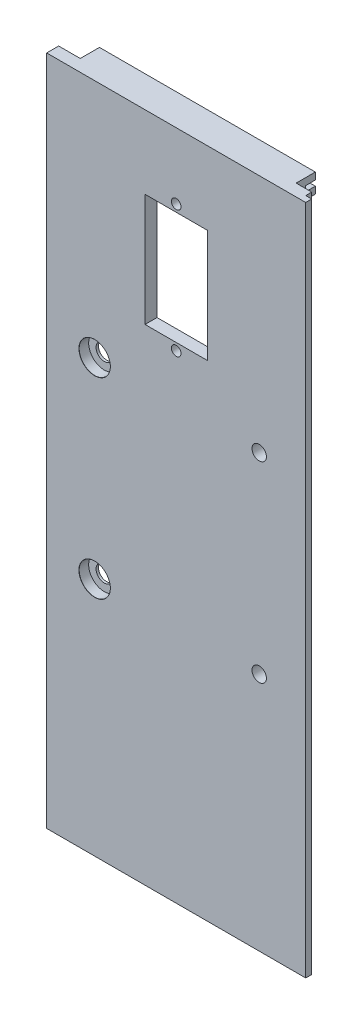
from build123d import *

# Parameters (mm, degrees)
ESBO_O1_W                                    = 54
ESBO_O1_H                                    = 140
RESSALTO_EXTRUS_O1_DEPTH                     = 2.5
ESBO_O2_W                                    = 45
ESBO_O2_H                                    = 4
RESSALTO_EXTRUS_O2_DEPTH                     = 4
FILETE1_R                                    = 2
ESBO_O3_W                                    = 45
ESBO_O3_H                                    = 1.1
CORTE_EXTRUS_O1_DEPTH                        = 2
REBAIXO_PARA_PARAFUSO_COM_CABE_A_RED_2_COUNT = 2
REBAIXO_PARA_PARAFUSO_COM_CABE_A_RED_2_PITCH = 40
ESBO_O7_R                                    = 1
ESBO_O7_W                                    = 13
ESBO_O7_H                                    = 23.5
CORTE_EXTRUS_O2_DEPTH                        = 108.148584859
ESBO_O8_W                                    = 4
ESBO_O8_H                                    = 60
RESSALTO_EXTRUS_O3_DEPTH                     = 7.5
ESBO_O9_W                                    = 2
ESBO_O9_H                                    = 58
CORTE_EXTRUS_O3_DEPTH                        = 2
ESBO_O11_W                                   = 4
ESBO_O11_H                                   = 8
RESSALTO_EXTRUS_O4_DEPTH                     = 4
ESBO_O12_W                                   = 2
ESBO_O12_H                                   = 4
CORTE_EXTRUS_O5_DEPTH                        = 6
ESBO_O13_R                                   = 1.6
CORTE_EXTRUS_O6_DEPTH                        = 4
FILETE2_R                                    = 2
FILETE3_R                                    = 2
FILETE4_R                                    = 2
ESBO_O16_W                                   = 1.25
ESBO_O16_H                                   = 140
CORTE_EXTRUS_O7_DEPTH                        = 1.25
FUROS_GUIA_COM_3_0MM2_D                      = 3
FUROS_GUIA_COM_3_0MM2_CSINK_D                = 3.05
FUROS_GUIA_COM_3_0MM2_CSINK_ANGLE            = 90


with BuildPart() as part:
    # Esboço1 → Ressalto-extrusão1 (new body)
    with BuildSketch(Plane.XY):
        with Locations((11.1085709, -29.931506849)):
            Rectangle(ESBO_O1_W, ESBO_O1_H)
    extrude(amount=RESSALTO_EXTRUS_O1_DEPTH)

    # Esboço2 → Ressalto-extrusão2 (add)
    with BuildSketch(Plane(origin=(0, 0, 0), x_dir=(-1, 0, 0), z_dir=(0, 0, -1))):
        with Locations((-11.1085709, 38.068493151)):
            Rectangle(ESBO_O2_W, ESBO_O2_H)
    extrude(amount=RESSALTO_EXTRUS_O2_DEPTH)

    # Filete1
    filete1_edges = [part.edges().sort_by_distance(p)[0] for p in [
        (11.1085709, 36.068493151, 0),
    ]]
    fillet(filete1_edges, radius=FILETE1_R)

    # Esboço3 → Corte-extrusão1 (cut)
    with BuildSketch(Plane(origin=(0, 0, -4), x_dir=(-1, 0, 0), z_dir=(0, 0, -1))):
        with Locations((-11.1085709, 38.068493151)):
            Rectangle(ESBO_O3_W, ESBO_O3_H)
    extrude(amount=-CORTE_EXTRUS_O1_DEPTH, mode=Mode.SUBTRACT)

    # Esboço6 → Rebaixo para parafuso com cabeça redonda de M31 (revolve, cut)
    with BuildSketch(Plane(origin=(-5.8914291, -9.931506849, 2.5), x_dir=(0, -1, 0), z_dir=(1, 0, 0))):
        Polygon((0, 0), (0, 6.5), (1.7, 6.5), (1.7, 2), (3.25, 2), (3.25, 0.025), (3.275, 0), align=None)
    rebaixo_para_parafuso_com_cabe_a_redonda = revolve(axis=Axis((-5.8914291, -9.931506849, 8.85), (0, 0, -1)), mode=Mode.SUBTRACT)

    # Rebaixo para parafuso com cabe_a red 2: Rebaixo para parafuso com cabeça redonda de M31 ×2
    with Locations(*[(0, -i * REBAIXO_PARA_PARAFUSO_COM_CABE_A_RED_2_PITCH, 0) for i in range(1, REBAIXO_PARA_PARAFUSO_COM_CABE_A_RED_2_COUNT)]):
        add(rebaixo_para_parafuso_com_cabe_a_redonda, mode=Mode.SUBTRACT)

    # Esboço7 → Corte-extrusão2 (cut, through all)
    with BuildSketch(Plane.XY.offset(2.5)):
        with Locations((11.1085709, 26.298789139)):
            Circle(ESBO_O7_R)
        with Locations((11.1085709, -0.201210861)):
            Circle(ESBO_O7_R)
        with Locations((11.1085709, 13.048789139)):
            Rectangle(ESBO_O7_W, ESBO_O7_H)
    extrude(amount=-CORTE_EXTRUS_O2_DEPTH, mode=Mode.SUBTRACT)

    # Esboço8 → Ressalto-extrusão3 (add)
    with BuildSketch(Plane(origin=(0, 0, 0), x_dir=(-1, 0, 0), z_dir=(0, 0, -1))):
        with Locations((-20.269857929, -30)):
            Rectangle(ESBO_O8_W, ESBO_O8_H)
    extrude(amount=RESSALTO_EXTRUS_O3_DEPTH)

    # Esboço9 → Corte-extrusão3 (cut)
    with BuildSketch(Plane(origin=(0, 0, -7.5), x_dir=(-1, 0, 0), z_dir=(0, 0, -1))):
        with Locations((-20.269857929, -29)):
            Rectangle(ESBO_O9_W, ESBO_O9_H)
    extrude(amount=-CORTE_EXTRUS_O3_DEPTH, mode=Mode.SUBTRACT)

    # Esboço11 → Ressalto-extrusão4 (add)
    with BuildSketch(Plane(origin=(0, 0, -7.5), x_dir=(-1, 0, 0), z_dir=(0, 0, -1))):
        with Locations((-20.269857929, -56)):
            Rectangle(ESBO_O11_W, ESBO_O11_H)
    extrude(amount=RESSALTO_EXTRUS_O4_DEPTH)

    # Esboço12 → Corte-extrusão5 (cut)
    with BuildSketch(Plane(origin=(0, -52, 0), x_dir=(1, 0, 0), z_dir=(0, 1, 0))):
        with Locations((20.269857929, 9.5)):
            Rectangle(ESBO_O12_W, ESBO_O12_H)
    extrude(amount=-CORTE_EXTRUS_O5_DEPTH, mode=Mode.SUBTRACT)

    # Esboço13 → Corte-extrusão6 (cut)
    with BuildSketch(Plane(origin=(22.269857929, 0, 0), x_dir=(0, 0, -1), z_dir=(1, 0, 0))):
        with Locations((8.5, -55)):
            Circle(ESBO_O13_R)
    extrude(amount=-CORTE_EXTRUS_O6_DEPTH, mode=Mode.SUBTRACT)

    # Filete2
    filete2_edges = [part.edges().sort_by_distance(p)[0] for p in [
        (18.769857929, -52, -7.5),
        (21.769857929, -52, -7.5),
    ]]
    fillet(filete2_edges, radius=FILETE2_R)

    # Filete3
    filete3_edges = [part.edges().sort_by_distance(p)[0] for p in [
        (20.269857929, -60, 0),
    ]]
    fillet(filete3_edges, radius=FILETE3_R)

    # Filete4
    filete4_edges = [part.edges().sort_by_distance(p)[0] for p in [
        (18.269857929, -31, 0),
        (22.269857929, -31, 0),
    ]]
    fillet(filete4_edges, radius=FILETE4_R)

    # Esboço16 → Corte-extrusão7 (cut)
    with BuildSketch(Plane(origin=(0, 0, 0), x_dir=(-1, 0, 0), z_dir=(0, 0, -1))):
        with Locations((-37.4835709, -29.931506849)):
            Rectangle(ESBO_O16_W, ESBO_O16_H)
    extrude(amount=-CORTE_EXTRUS_O7_DEPTH, mode=Mode.SUBTRACT)

    # Furos-guia com Ø3.0mm2 (through all)
    with Locations(Plane(origin=(0, 0, 0), x_dir=(-1, 0, 0), z_dir=(0, 0, -1))):
        with Locations((-28.4085709, -9.931506849), (-28.4085709, -49.931506849)):
            CounterSinkHole(FUROS_GUIA_COM_3_0MM2_D / 2, FUROS_GUIA_COM_3_0MM2_CSINK_D / 2, counter_sink_angle=FUROS_GUIA_COM_3_0MM2_CSINK_ANGLE)


solid = part.part
